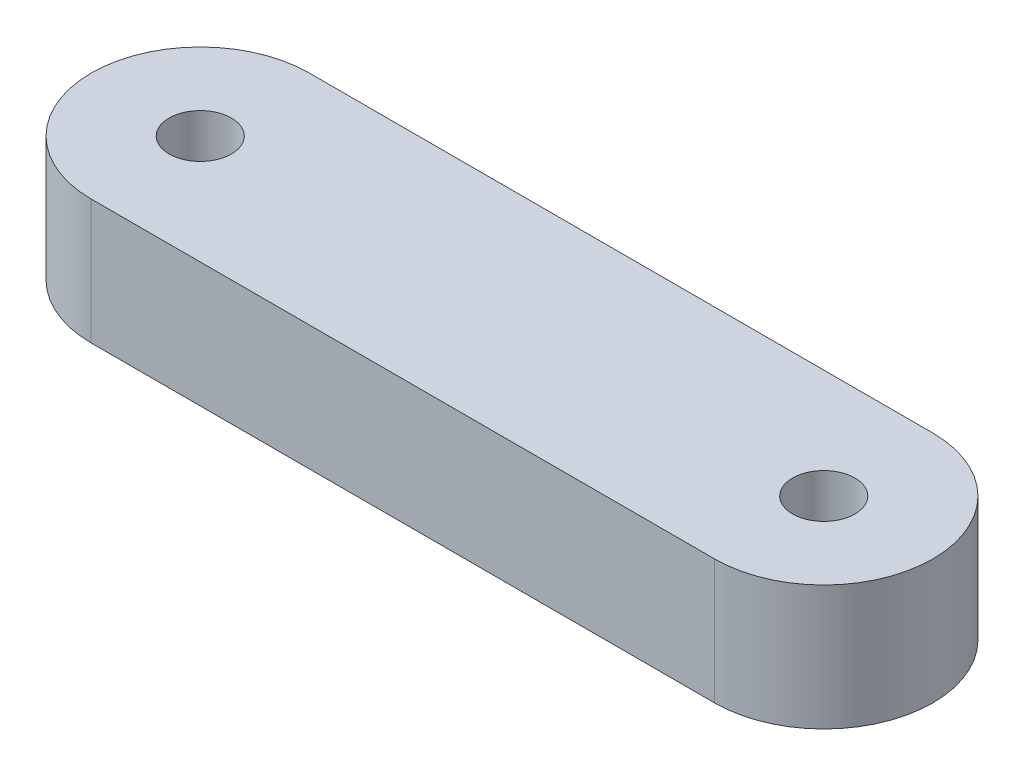
from build123d import *

# Parameters (mm, degrees)
SKETCH1_R           = 2.5
BOSS_EXTRUDE1_DEPTH = 10


with BuildPart() as part:
    # Sketch1 → Boss-Extrude1 (new body)
    with BuildSketch(Plane(origin=(0, 0, 0), x_dir=(1, 0, 0), z_dir=(0, 1, 0))):
        with BuildLine():
            Line((0, -8.746700341), (-50, -8.746700341))
            ThreePointArc((-50, -8.746700341), (-58.746700341, 0), (-50, 8.746700341))
            Line((-50, 8.746700341), (0, 8.746700341))
            ThreePointArc((0, 8.746700341), (8.746700341, 0), (0, -8.746700341))
        make_face()
        Circle(SKETCH1_R, mode=Mode.SUBTRACT)
        with Locations((-50, 0)):
            Circle(SKETCH1_R, mode=Mode.SUBTRACT)
    extrude(amount=BOSS_EXTRUDE1_DEPTH)


solid = part.part
